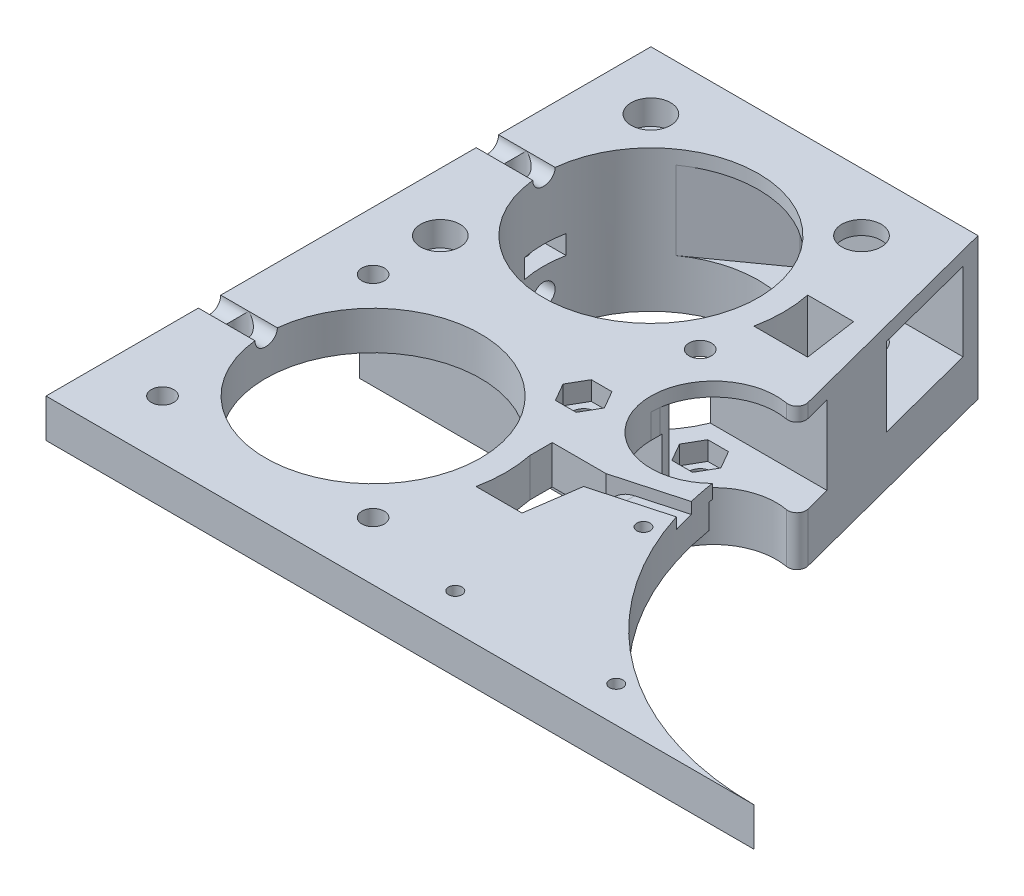
from build123d import *
from OCP.BRepAlgoAPI import BRepAlgoAPI_Cut
from OCP.TopTools import TopTools_ListOfShape

# Parameters (mm, degrees)
SALIENTE_EXTRUIR4_DEPTH     = 8.6
SALIENTE_EXTRUIR2_DEPTH     = 23
CORTAR_EXTRUIR1_DEPTH       = 174.347194959
CORTAR_EXTRUIR1_DEPTH_BACK  = 174.347194959
CROQUIS2_R                  = 14
CROQUIS2_R_2                = 24
CROQUIS5_R                  = 2.5
CORTAR_EXTRUIR2_DEPTH       = 175.696336539
SALIENTE_EXTRUIR3_START     = -15.6
SALIENTE_EXTRUIR3_DEPTH     = 15.6
CORTAR_EXTRUIR3_DEPTH       = 174.347194959
CORTAR_EXTRUIR3_DEPTH_BACK  = 174.347194959
CROQUIS7_R                  = 6
CORTAR_EXTRUIR4_DEPTH       = 5
CORTAR_EXTRUIR4_DEPTH_BACK  = 12.5
REDONDEO1_R                 = 2
CROQUIS9_R                  = 16.85
CROQUIS9_R_2                = 6
SALIENTE_EXTRUIR5_DEPTH     = 4.65
CROQUIS10_R                 = 10
CROQUIS10_R_2               = 6
SALIENTE_EXTRUIR6_DEPTH     = 29
REDONDEO2_R                 = 0.5
REDONDEO3_R                 = 2
SALIENTE_EXTRUIR7_REACH     = 177.079
CROQUIS12_R                 = 1.5
CORTAR_EXTRUIR5_DEPTH       = 174.111445318
CORTAR_EXTRUIR6_DEPTH       = 2
CROQUIS14_R                 = 3
CORTAR_EXTRUIR7_DEPTH       = 3.7
CORTAR_EXTRUIR11_DEPTH      = 2.5
CROQUIS20_W                 = 12
CROQUIS20_H                 = 5
CORTAR_EXTRUIR12_DEPTH      = 176.700917755
REDONDEO4_R                 = 5
CORTAR_EXTRUIR13_DEPTH      = 176.700917755
CORTAR_EXTRUIR13_DEPTH_BACK = 176.700917755
CROQUIS21_OUTSIDE_W         = 280.576
CROQUIS21_OUTSIDE_H         = 190.076
CORTAR_EXTRUIR14_DEPTH      = 7
CORTAR_EXTRUIR15_DEPTH      = 175.696336539
CORTAR_EXTRUIR15_DEPTH_BACK = 175.696336539
CROQUIS25_R                 = 4.4
CORTAR_EXTRUIR16_DEPTH      = 5.5
CROQUIS26_R                 = 4.4
CORTAR_EXTRUIR17_DEPTH      = 5.5
CROQUIS27_R                 = 2.5
CORTAR_EXTRUIR18_DEPTH      = 175.696336539
CORTAR_EXTRUIR19_DEPTH      = 174.045109726
CORTAR_EXTRUIR19_DEPTH_BACK = 5.5
CROQUIS28_R                 = 4.4
CORTAR_EXTRUIR20_DEPTH      = 173.539531702
CORTAR_EXTRUIR20_DEPTH_BACK = 173.539531702
CROQUIS29_R                 = 2.5
CORTAR_EXTRUIR21_DEPTH      = 2.125
CORTAR_EXTRUIR23_START      = -14
CORTAR_EXTRUIR23_DEPTH      = 15
CORTAR_EXTRUIR24_REACH      = 175.347
CORTAR_EXTRUIR24_END_RADIUS = 24
CROQUIS33_R                 = 2.5
CORTAR_EXTRUIR25_REACH      = 175.347
CORTAR_EXTRUIR25_END_RADIUS = 24
CROQUIS34_R                 = 2.5
CORTAR_EXTRUIR26_DEPTH      = 4.2
CORTAR_EXTRUIR27_DEPTH      = 4.2


with BuildPart() as part:
    # Croquis1 → Saliente-Extruir4 (new body)
    with BuildSketch(Plane(origin=(0, 0, 0), x_dir=(1, 0, 0), z_dir=(0, 1, 0))):
        with BuildLine():
            Line((0, -67.5), (-158, -67.5))
            Line((-158, -67.5), (-158, 67.5))
            Line((-158, 67.5), (0, 67.5))
            ThreePointArc((0, 67.5), (67.5, 0), (0, -67.5))
        make_face()
    extrude(amount=SALIENTE_EXTRUIR4_DEPTH)

    # Croquis3 → Saliente-Extruir2 (add)
    with BuildSketch(Plane.XZ):
        Polygon((-85, -67.5), (-68.148148148, -2.5), (-158, -2.5), (-158, -67.5), align=None)
    extrude(amount=SALIENTE_EXTRUIR2_DEPTH)

    # Croquis2 → Cortar-Extruir1 (cut, two sides: drawn at the far end of the back side and taken through both)
    with BuildSketch(Plane(origin=(0, 0, 0), x_dir=(1, 0, 0), z_dir=(0, 1, 0)).offset(-CORTAR_EXTRUIR1_DEPTH_BACK)):
        with Locations(Location((-76.5, 0, 0), (0, 0, 66.051358792))):
            Circle(CROQUIS2_R)
        with Locations(Location((-121.5, 31, 0), (0, 0, 90))):
            Circle(CROQUIS2_R_2)
        with Locations(Location((-121.5, -31, 0), (0, 0, 90))):
            Circle(CROQUIS2_R_2)
    extrude(amount=CORTAR_EXTRUIR1_DEPTH + CORTAR_EXTRUIR1_DEPTH_BACK, mode=Mode.SUBTRACT)

    # Croquis5 → Cortar-Extruir2 (cut, through all)
    with BuildSketch(Plane(origin=(0, 8.6, 0), x_dir=(1, 0, 0), z_dir=(0, 1, 0))):
        with Locations(Location((-145, -7.5, 0), (0, 0, 270))):
            Circle(CROQUIS5_R)
        with Locations(Location((-145, -54.5, 0), (0, 0, 270))):
            Circle(CROQUIS5_R)
        with Locations(Location((-98, -54.5, 0), (0, 0, 270))):
            Circle(CROQUIS5_R)
        with Locations(Location((-98, -7.5, 0), (0, 0, 270))):
            Circle(CROQUIS5_R)
        with Locations(Location((-145, 7.5, 0), (0, 0, 270))):
            Circle(CROQUIS5_R)
        with Locations(Location((-145, 54.5, 0), (0, 0, 270))):
            Circle(CROQUIS5_R)
    extrude(amount=-CORTAR_EXTRUIR2_DEPTH, mode=Mode.SUBTRACT)

    # Croquis6 → Saliente-Extruir3 (add)
    with BuildSketch(Plane(origin=(0, 8.6, 0), x_dir=(1, 0, 0), z_dir=(0, 1, 0)).offset(SALIENTE_EXTRUIR3_START)):
        with BuildLine():
            Line((0, -67.5), (-85, -67.5))
            Line((-85, -67.5), (-70.817153658, -12.794735536))
            ThreePointArc((-70.817153658, -12.794735536), (-62.5, 0), (-70.817153658, 12.794735536))
            Line((-70.817153658, 12.794735536), (-85, 67.5))
            Line((-85, 67.5), (0, 67.5))
            ThreePointArc((0, 67.5), (67.5, 0), (0, -67.5))
        make_face()
    extrude(amount=SALIENTE_EXTRUIR3_DEPTH)

    # Croquis7 → Cortar-Extruir3 (cut, two sides: drawn at the far end of the back side and taken through both)
    with BuildSketch(Plane(origin=(0, 0, 0), x_dir=(1, 0, 0), z_dir=(0, 1, 0)).offset(-CORTAR_EXTRUIR3_DEPTH_BACK)):
        with Locations(Location((0, 0, 0), (0, 0, 270))):
            Circle(CROQUIS7_R)
    extrude(amount=CORTAR_EXTRUIR3_DEPTH + CORTAR_EXTRUIR3_DEPTH_BACK, mode=Mode.SUBTRACT)

    # Croquis8 → Cortar-Extruir4 (cut, two sides: drawn at the far end of the back side and taken through both)
    with BuildSketch(Plane.XZ.offset(7).offset(-CORTAR_EXTRUIR4_DEPTH_BACK)):
        with BuildLine():
            Line((0, -63), (-116.397014468, -63))
            ThreePointArc((-116.397014468, -63), (-117.923471798, -62.761294784), (-119.304179798, -62.067971208))
            Line((-119.304179798, -62.067971208), (-135.454393581, -50.526261798))
            ThreePointArc((-135.454393581, -50.526261798), (-144.354214963, -23.673004816), (-121.5, -7))
            Line((-121.5, -7), (-95.5, -7))
            ThreePointArc((-95.5, -7), (-91.964466094, -5.535533906), (-90.5, -2))
            Line((-90.5, -2), (-90.5, 0))
            ThreePointArc((-90.5, 0), (-84.130208097, 11.737969347), (-70.817153658, 12.794735536))
            ThreePointArc((-70.817153658, 12.794735536), (-69.810181657, 12.29822469), (-68.84623323, 11.722621474))
            ThreePointArc((-68.84623323, 11.722621474), (-64.266892893, 11.262463458), (-61.251513841, 14.739472589))
            ThreePointArc((-61.251513841, 14.739472589), (49.485284546, 38.989827051), (0, -63))
        make_face()
    extrude(amount=CORTAR_EXTRUIR4_DEPTH + CORTAR_EXTRUIR4_DEPTH_BACK, mode=Mode.SUBTRACT)


with BuildPart() as cortar_extruir4_kept_piece:
    # of the separate pieces the step leaves, the one the design keeps (cortar_extruir4_pieces_kept)
    add(part.part.solids().sort_by_distance((0, 8.6, 67.5))[0])

    # Redondeo1
    redondeo1_edges = [cortar_extruir4_kept_piece.edges().sort_by_distance(p)[0] for p in [
        (-70.817153658, -17.5, -12.794735536),
    ]]
    fillet(redondeo1_edges, radius=REDONDEO1_R)

    # Croquis9 → Saliente-Extruir5 (add)
    with BuildSketch(Plane.XZ.offset(-5.5)):
        with Locations(Location((0, 0, 0), (0, 0, 270))):
            Circle(CROQUIS9_R)
        with Locations(Location((0, 0, 0), (0, 0, 90))):
            Circle(CROQUIS9_R_2, mode=Mode.SUBTRACT)
    extrude(amount=SALIENTE_EXTRUIR5_DEPTH)

    # Croquis10 → Saliente-Extruir6 (add)
    with BuildSketch(Plane.XZ.offset(-0.85)):
        with Locations(Location((0, 0, 0), (0, 0, 90))):
            Circle(CROQUIS10_R)
        with Locations(Location((0, 0, 0), (0, 0, 90))):
            Circle(CROQUIS10_R_2, mode=Mode.SUBTRACT)
    extrude(amount=SALIENTE_EXTRUIR6_DEPTH)

    # Redondeo2
    redondeo2_edges = [cortar_extruir4_kept_piece.edges().sort_by_distance(p)[0] for p in [
        (0, 0.85, 16.85),
    ]]
    fillet(redondeo2_edges, radius=REDONDEO2_R)

    # Redondeo3
    redondeo3_edges = [cortar_extruir4_kept_piece.edges().sort_by_distance(p)[0] for p in [
        (0, 5.5, 16.85),
    ]]
    fillet(redondeo3_edges, radius=REDONDEO3_R)

    # Croquis11 → Saliente-Extruir7 (add, up to next)
    with BuildSketch(Plane.XZ.offset(-5.5), mode=Mode.PRIVATE) as saliente_extruir7_sk1:
        with BuildLine():
            Line((-73.203703704, -22), (-77.87037037, -40))
            Line((-77.87037037, -40), (-99.251404539, -40))
            ThreePointArc((-99.251404539, -40), (-97.5, -31), (-99.251404539, -22))
            Line((-99.251404539, -22), (-73.203703704, -22))
        make_face()
    saliente_extruir7_tool1 = extrude(saliente_extruir7_sk1.sketch, amount=SALIENTE_EXTRUIR7_REACH, mode=Mode.PRIVATE) - cortar_extruir4_kept_piece.part
    add(saliente_extruir7_tool1.solids().sort_by_distance((-86.771742, 5.5, -30.689413))[0])

    # Croquis12 → Cortar-Extruir5 (cut, through all)
    with BuildSketch(Plane.XZ.offset(7)):
        with Locations(Location((-74.661436633, 59.5, 0), (0, 0, 270))):
            Circle(CROQUIS12_R)
        with Locations(Location((-66.012679429, 26.140507926, 0), (0, 0, 270))):
            Circle(CROQUIS12_R)
        with Locations(Location((-38.73951471, 59.5, 0), (0, 0, 270))):
            Circle(CROQUIS12_R)
        with Locations(Location((-38.73951471, -59.5, 0), (0, 0, 270))):
            Circle(CROQUIS12_R)
        with Locations(Location((-74.661436633, -59.5, 0), (0, 0, 270))):
            Circle(CROQUIS12_R)
        with Locations(Location((-66.012679429, -26.140507926, 0), (0, 0, 270))):
            Circle(CROQUIS12_R)
    extrude(amount=-CORTAR_EXTRUIR5_DEPTH, mode=Mode.SUBTRACT)

    # Croquis13 → Cortar-Extruir6 (cut)
    with BuildSketch(Plane.XZ.offset(-5.5)):
        Polygon((-70.908659884, -59.5), (-72.785048259, -56.25), (-76.537825008, -56.25), (-78.414213383, -59.5), (-76.537825008, -62.75), (-72.785048259, -62.75), align=None)
        Polygon((-62.259902679, -26.140507926), (-64.136291054, -22.890507926), (-67.889067804, -22.890507926), (-69.765456179, -26.140507926), (-67.889067804, -29.390507926), (-64.136291054, -29.390507926), align=None)
        Polygon((-34.986737961, -59.5), (-36.863126336, -56.25), (-40.615903085, -56.25), (-42.49229146, -59.5), (-40.615903085, -62.75), (-36.863126336, -62.75), align=None)
    extrude(amount=-CORTAR_EXTRUIR6_DEPTH, mode=Mode.SUBTRACT)

    # Croquis14 → Cortar-Extruir7 (cut)
    with BuildSketch(Plane.XZ.offset(7)):
        with Locations(Location((-66.012679429, 26.140507926, 0), (0, 0, 270))):
            Circle(CROQUIS14_R)
        with Locations(Location((-74.661436633, 59.5, 0), (0, 0, 270))):
            Circle(CROQUIS14_R)
        with Locations(Location((-38.73951471, 59.5, 0), (0, 0, 270))):
            Circle(CROQUIS14_R)
    extrude(amount=-CORTAR_EXTRUIR7_DEPTH, mode=Mode.SUBTRACT)

    # Croquis19 → Cortar-Extruir11 (cut)
    with BuildSketch(Plane(origin=(0, 8.6, 0), x_dir=(1, 0, 0), z_dir=(0, 1, 0))):
        Polygon((-52.482988664, -17.255771853), (-40.471682692, -33.003928572), (-36.496071428, -29.971682692), (-51.657300826, -10.09362637), (-55.63291209, -13.12587225), (-80.518518519, -20), (-92.518518519, -20), (-92.518518519, -25), (-80.518518519, -25), align=None)
    extrude(amount=-CORTAR_EXTRUIR11_DEPTH, mode=Mode.SUBTRACT)

    # Croquis20 → Cortar-Extruir12 (cut, through all)
    with BuildSketch(Plane(origin=(0, 8.6, 0), x_dir=(1, 0, 0), z_dir=(0, 1, 0))):
        with Locations((-86.518518519, -22.5)):
            Rectangle(CROQUIS20_W, CROQUIS20_H)
    extrude(amount=-CORTAR_EXTRUIR12_DEPTH, mode=Mode.SUBTRACT)

    # Redondeo4
    # the kernel refuses this fillet: 5 mm, written as the material it takes off along each edge
    with BuildSketch(Plane(origin=(-80.518518519, 6.1, 25), x_dir=(0, -1, 0), z_dir=(0, 0, -1))) as redondeo4_piece_1_section:
        with BuildLine():
            CenterArc((REDONDEO4_R, -REDONDEO4_R), REDONDEO4_R, 90, 90)
            Line((0, -REDONDEO4_R), (0, 0))
            Line((0, 0), (REDONDEO4_R, 0))
        make_face()
    redondeo4_piece_1 = extrude(amount=5, mode=Mode.PRIVATE)
    redondeo4_piece_1 = split(redondeo4_piece_1, bisect_by=Plane(origin=(-80.518518519, 6.1, 25), z_dir=(-0.26625771274306753, 0, -0.9639018779963188)), keep=Keep.TOP, mode=Mode.PRIVATE)
    redondeo4_piece_1 = split(redondeo4_piece_1, bisect_by=Plane(origin=(-81.801750065, 6.1, 20.354465848), z_dir=(0.2662577127430677, 0, 0.9639018779963188)), keep=Keep.TOP, mode=Mode.PRIVATE)
    add(redondeo4_piece_1, mode=Mode.SUBTRACT)
    with BuildSketch(Plane(origin=(-80.518518519, 6.1, 25), x_dir=(0, -1, 0), z_dir=(0, 0, -1))) as redondeo4_piece_2_section:
        with BuildLine():
            CenterArc((REDONDEO4_R, -REDONDEO4_R), REDONDEO4_R, 90, 90)
            Line((0, -REDONDEO4_R), (0, 0))
            Line((0, 0), (REDONDEO4_R, 0))
        make_face()
    redondeo4_piece_2 = extrude(amount=17.5, mode=Mode.PRIVATE)
    redondeo4_piece_2 = split(redondeo4_piece_2, bisect_by=Plane(origin=(-81.801750065, 6.1, 20.354465848), z_dir=(0.2662577127430677, 0, 0.9639018779963188)), keep=Keep.TOP, mode=Mode.PRIVATE)
    redondeo4_piece_2 = split(redondeo4_piece_2, bisect_by=Plane(origin=(-80.518518519, 6.1, 20), z_dir=(0, 0, -1)), keep=Keep.TOP, mode=Mode.PRIVATE)
    add(redondeo4_piece_2, mode=Mode.SUBTRACT)

    # Croquis21 outside → Cortar-Extruir13 (cut, two sides: drawn at the far end of the back side and taken through both)
    with BuildSketch(Plane(origin=(0, 8.6, 0), x_dir=(1, 0, 0), z_dir=(0, 1, 0)).offset(-CORTAR_EXTRUIR13_DEPTH_BACK)):
        with Locations((-45.25, 0)):
            Rectangle(CROQUIS21_OUTSIDE_W, CROQUIS21_OUTSIDE_H)
        with BuildLine():
            Line((-158, 67.5), (-158, -67.5))
            Line((-158, -67.5), (0, -67.5))
            ThreePointArc((0, -67.5), (-44.035215296, -51.158086495), (-66.748366013, -10.045179669))
            ThreePointArc((-66.748366013, -10.045179669), (-89.892473531, -4.079418185), (-74.004352038, 13.775766449))
            ThreePointArc((-74.004352038, 13.775766449), (-72.181961261, 14.383135348), (-71.711837104, 16.245657402))
            Line((-71.711837104, 16.245657402), (-73.203703704, 22))
            Line((-73.203703704, 22), (-77.87037037, 40))
            Line((-77.87037037, 40), (-83.833333333, 63))
            Line((-83.833333333, 63), (-85, 67.5))
            Line((-85, 67.5), (-158, 67.5))
        make_face(mode=Mode.SUBTRACT)
    extrude(amount=CORTAR_EXTRUIR13_DEPTH + CORTAR_EXTRUIR13_DEPTH_BACK, mode=Mode.SUBTRACT)

    # Croquis22 → Cortar-Extruir14 (cut)
    with BuildSketch(Plane.XZ.offset(7)):
        with BuildLine():
            Line((-70.817153658, 12.794735536), (-85, 67.5))
            add(Edge.make_bspline(
                [(-85, 67.5), (12.806206693, 155.320362692), (41.731835717, 17.320207562), (-80.174689399, -16.093750054), (-70.817153658, 12.794735536)],
                knots=[0, 0, 0, 0, 0.745807845, 1, 1, 1, 1], degree=3))
        make_face()
    extrude(amount=-CORTAR_EXTRUIR14_DEPTH, mode=Mode.SUBTRACT)

    # Croquis24 → Cortar-Extruir15 (cut, two sides: drawn at the far end of the back side and taken through both)
    with BuildSketch(Plane(origin=(0, 8.6, 0), x_dir=(1, 0, 0), z_dir=(0, 1, 0)).offset(-CORTAR_EXTRUIR15_DEPTH_BACK)):
        with BuildLine():
            Line((-82.2578984, 37), (-80.518518519, 25))
            Line((-80.518518519, 25), (-92.518518519, 25))
            ThreePointArc((-92.518518519, 25), (-91.903948424, 31), (-92.518518519, 37))
            Line((-92.518518519, 37), (-82.2578984, 37))
        make_face()
        with BuildLine():
            Line((-80.518518519, -25), (-92.518518519, -25))
            ThreePointArc((-92.518518519, -25), (-91.903948424, -31), (-92.518518519, -37))
            Line((-92.518518519, -37), (-82.2578984, -37))
            Line((-82.2578984, -37), (-80.518518519, -25))
        make_face()
    extrude(amount=CORTAR_EXTRUIR15_DEPTH + CORTAR_EXTRUIR15_DEPTH_BACK, mode=Mode.SUBTRACT)

    # Croquis25 → Cortar-Extruir16 (cut)
    with BuildSketch(Plane(origin=(0, 8.6, 0), x_dir=(1, 0, 0), z_dir=(0, 1, 0))):
        with Locations(Location((-145, 54.5, 0), (0, 0, 270))):
            Circle(CROQUIS25_R)
        with Locations(Location((-145, 7.5, 0), (0, 0, 270))):
            Circle(CROQUIS25_R)
    extrude(amount=-CORTAR_EXTRUIR16_DEPTH, mode=Mode.SUBTRACT)

    # Croquis26 → Cortar-Extruir17 (cut)
    with BuildSketch(Plane.XZ.offset(23)):
        with Locations(Location((-145, -54.5, 0), (0, 0, 90))):
            Circle(CROQUIS26_R)
        with Locations(Location((-145, -7.5, 0), (0, 0, 90))):
            Circle(CROQUIS26_R)
    extrude(amount=-CORTAR_EXTRUIR17_DEPTH, mode=Mode.SUBTRACT)

    # Croquis27 → Cortar-Extruir18 (cut, through all)
    with BuildSketch(Plane(origin=(0, 8.6, 0), x_dir=(1, 0, 0), z_dir=(0, 1, 0))):
        with Locations(Location((-98, 54.5, 0), (0, 0, 90))):
            Circle(CROQUIS27_R)
    extrude(amount=-CORTAR_EXTRUIR18_DEPTH, mode=Mode.SUBTRACT)

    # Croquis28 → Cortar-Extruir19 (cut, two sides: drawn at the far end of the back side and taken through both)
    with BuildSketch(Plane(origin=(0, -12, 0), x_dir=(1, 0, 0), z_dir=(0, 1, 0)).offset(-CORTAR_EXTRUIR19_DEPTH_BACK)):
        with Locations(Location((-98, 54.5, 0), (0, 0, 90))):
            Circle(CROQUIS28_R)
    extrude(amount=CORTAR_EXTRUIR19_DEPTH + CORTAR_EXTRUIR19_DEPTH_BACK, mode=Mode.SUBTRACT)

    # Croquis29 → Cortar-Extruir20 (cut, two sides: drawn at the far end of the back side and taken through both)
    with BuildSketch(Plane(origin=(0, -7.2, 0), x_dir=(-1, 0, 0), z_dir=(0, -1, 0)).offset(-CORTAR_EXTRUIR20_DEPTH_BACK)):
        with Locations(Location((151.75, 31, 0), (0, 0, 90))):
            Circle(CROQUIS29_R)
        with Locations(Location((151.75, -31, 0), (0, 0, 270))):
            Circle(CROQUIS29_R)
        with Locations(Location((94, 14.5, 0), (0, 0, 90))):
            Circle(CROQUIS29_R)
    extrude(amount=CORTAR_EXTRUIR20_DEPTH + CORTAR_EXTRUIR20_DEPTH_BACK, mode=Mode.SUBTRACT)

    # Croquis30 → Cortar-Extruir21 (cut, symmetric)
    with BuildSketch(Plane(origin=(0, -7.2, 0), x_dir=(-1, 0, 0), z_dir=(0, -1, 0))):
        with BuildLine():
            Line((151.75, 35.618802154), (145.05136231, 35.618802154))
            ThreePointArc((145.05136231, 35.618802154), (145.5, 31), (145.05136231, 26.381197846))
            Line((145.05136231, 26.381197846), (151.75, 26.381197846))
            Line((151.75, 26.381197846), (155.75, 28.690598923))
            Line((155.75, 28.690598923), (155.75, 33.309401077))
            Line((155.75, 33.309401077), (151.75, 35.618802154))
        make_face()
    extrude(amount=CORTAR_EXTRUIR21_DEPTH, both=True, mode=Mode.SUBTRACT)


with BuildPart() as cortar_extruir23_tool:
    # Cortar-Extruir23: read off the stored shape, not the designer's step
    # Cortar-Extruir23 outline → Cortar-Extruir23 (new body)
    with BuildSketch(Plane.ZY.offset(158).offset(CORTAR_EXTRUIR23_START)):
        with BuildLine():
            Line((33.5, 8.6), (28.5, 8.6))
            ThreePointArc((28.5, 8.6), (31, 6.1), (33.5, 8.6))
        make_face()
    extrude(amount=CORTAR_EXTRUIR23_DEPTH)


with BuildPart() as cortar_extruir4_kept_piece_1:
    add(cortar_extruir4_kept_piece.part)

    # Cortar-Extruir23: cut by cortar_extruir23_tool, with a tolerance
    cortar_extruir23_stock = TopTools_ListOfShape()
    cortar_extruir23_stock.Append(cortar_extruir4_kept_piece_1.part.wrapped)
    cortar_extruir23_tools = TopTools_ListOfShape()
    cortar_extruir23_tools.Append(cortar_extruir23_tool.part.wrapped)
    cortar_extruir23_cut = BRepAlgoAPI_Cut()
    cortar_extruir23_cut.SetArguments(cortar_extruir23_stock)
    cortar_extruir23_cut.SetTools(cortar_extruir23_tools)
    cortar_extruir23_cut.SetFuzzyValue(0.00001)
    cortar_extruir23_cut.Build()
    add(Compound.cast(cortar_extruir23_cut.Shape()).solids(), mode=Mode.REPLACE)

    # Cortar-Extruir24: up to this cylinder (the profile starts outside it)
    cortar_extruir24_end = Plane(origin=(-121.5, 8.6, -31), z_dir=(0, -1, 0)) * Cylinder(CORTAR_EXTRUIR24_END_RADIUS, 399.694, mode=Mode.PRIVATE)
    # Croquis33 → Cortar-Extruir24 (cut, up to the surface)
    with BuildSketch(Plane.ZY.offset(158), mode=Mode.PRIVATE) as cortar_extruir24_sk1:
        with Locations((-31, 8.6)):
            Circle(CROQUIS33_R)
    cortar_extruir24_tool1 = extrude(cortar_extruir24_sk1.sketch, amount=-CORTAR_EXTRUIR24_REACH, mode=Mode.PRIVATE) - cortar_extruir24_end
    add(cortar_extruir24_tool1.solids().sort_by_distance((-158, 8.6, -31))[0], mode=Mode.SUBTRACT)

    # Cortar-Extruir25: up to this cylinder (the profile starts outside it)
    cortar_extruir25_end = Plane(origin=(-121.5, -14.9, -31), z_dir=(0, -1, 0)) * Cylinder(CORTAR_EXTRUIR25_END_RADIUS, 399.694, mode=Mode.PRIVATE)
    # Croquis34 → Cortar-Extruir25 (cut, up to the surface)
    with BuildSketch(Plane.ZY.offset(158), mode=Mode.PRIVATE) as cortar_extruir25_sk1:
        with Locations((-31, -14.9)):
            Circle(CROQUIS34_R)
    cortar_extruir25_tool1 = extrude(cortar_extruir25_sk1.sketch, amount=-CORTAR_EXTRUIR25_REACH, mode=Mode.PRIVATE) - cortar_extruir25_end
    add(cortar_extruir25_tool1.solids().sort_by_distance((-158, -14.9, -31))[0], mode=Mode.SUBTRACT)

    # Croquis35 → Cortar-Extruir26 (cut)
    with BuildSketch(Plane(origin=(0, -12, 0), x_dir=(1, 0, 0), z_dir=(0, 1, 0))):
        Polygon((-89.381197846, 14.5), (-91.690598923, 18.5), (-96.309401077, 18.5), (-98.618802154, 14.5), (-96.309401077, 10.5), (-91.690598923, 10.5), align=None)
    extrude(amount=-CORTAR_EXTRUIR26_DEPTH, mode=Mode.SUBTRACT)

    # Croquis36 → Cortar-Extruir27 (cut)
    with BuildSketch(Plane(origin=(0, 8.6, 0), x_dir=(1, 0, 0), z_dir=(0, 1, 0))):
        Polygon((-93.381197846, -7.5), (-95.690598923, -3.5), (-100.309401077, -3.5), (-102.618802154, -7.5), (-100.309401077, -11.5), (-95.690598923, -11.5), align=None)
    extrude(amount=-CORTAR_EXTRUIR27_DEPTH, mode=Mode.SUBTRACT)


solid = cortar_extruir4_kept_piece_1.part
